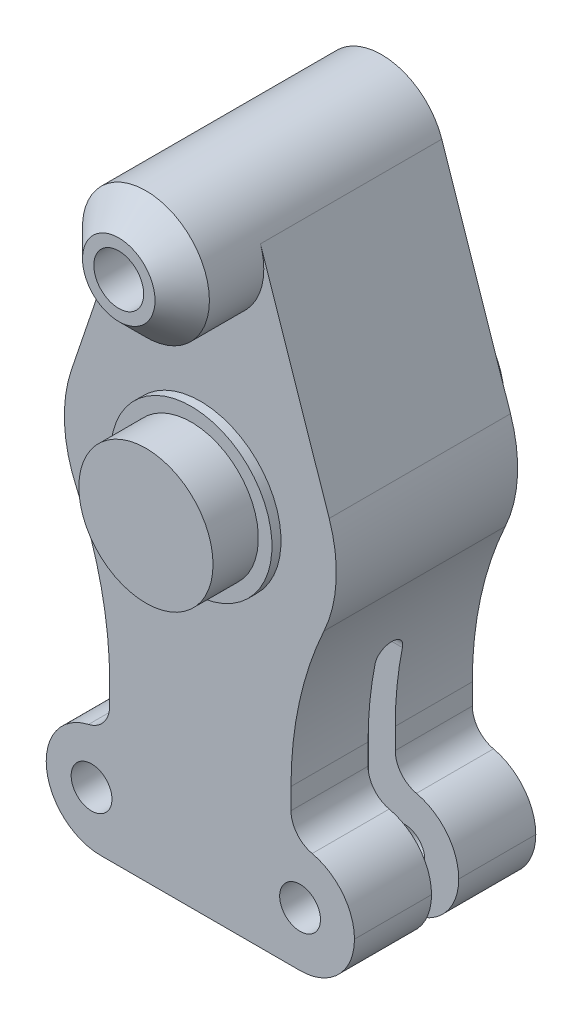
from build123d import *

# Parameters (mm, degrees)
SKETCH_1_R                  = 7.4
EXTRUDE_1_DEPTH             = 5
SKETCH_2_R                  = 8.9
EXTRUDE_2_DEPTH             = 1
SKETCH_3_R                  = 15
EXTRUDE_3_DEPTH             = 20
SKETCH_11_W                 = 20
SKETCH_11_H                 = 20
EXTRUDE_8_DEPTH             = 40
EXTRUDE_4_DEPTH             = 20
EXTRUDE_START               = 9
SKETCH_5_R                  = 7
EXTRUDE_5_DEPTH             = 9
HOLE_WIZARD_M51_D           = 5.5
HOLE_WIZARD_M51_CBORE_D     = 10.5
HOLE_WIZARD_M51_CBORE_DEPTH = 14
CHAMFER_1_SIZE              = 3
FILLET_20_R                 = 40
SKETCH_8_R                  = 9
EXTRUDE_6_DEPTH             = 1
SKETCH_9_R                  = 7.5
EXTRUDE_7_DEPTH             = 5
SKETCH_13_W                 = 34
SKETCH_13_H                 = 20
EXTRUDE_9_DEPTH             = 12
SKETCH_14_R                 = 7.2
CUT_EXTRUDE_3_DEPTH         = 45
SKETCH_15_W                 = 34
SKETCH_15_H                 = 3
CUT_EXTRUDE_4_DEPTH         = 25
CUT_EXTRUDE_5_DEPTH         = 52.166395
CUT_EXTRUDE_5_DEPTH_BACK    = 52.166395
FILLET_14_R                 = 1
CUT_EXTRUDE_6_DEPTH         = 14
CUT_EXTRUDE_7_DEPTH         = 64.584589
SKETCH_19_W                 = 5.4
SKETCH_19_H                 = 10.4
CUT_EXTRUDE_8_DEPTH         = 5
FILLET_15_R                 = 1
FILLET_18_R                 = 0.4
HOLE_WIZARD_M41_D           = 4.5
FILLET_19_R                 = 6
FILLET_21_R                 = 3


with BuildPart() as part:
    # Эскиз1 → Бобышка-Вытянуть1 (new body)
    with BuildSketch(Plane.XY):
        Circle(SKETCH_1_R)
    extrude(amount=EXTRUDE_1_DEPTH)

    # Эскиз2 → Бобышка-Вытянуть2 (add)
    with BuildSketch(Plane(origin=(0, 0, 0), x_dir=(-1, 0, 0), z_dir=(0, 0, -1))):
        Circle(SKETCH_2_R)
    extrude(amount=EXTRUDE_2_DEPTH)

    # Эскиз3 → Бобышка-Вытянуть3 (add)
    with BuildSketch(Plane(origin=(0, 0, -1), x_dir=(-1, 0, 0), z_dir=(0, 0, -1))):
        Circle(SKETCH_3_R)
    extrude(amount=EXTRUDE_3_DEPTH)

    # Эскиз11 → Бобышка-Вытянуть8 (add)
    with BuildSketch(Plane(origin=(0, 0, 0), x_dir=(1, 0, 0), z_dir=(0, 1, 0))):
        with Locations((0, 11)):
            Rectangle(SKETCH_11_W, SKETCH_11_H)
    extrude(amount=-EXTRUDE_8_DEPTH)

    # Эскиз4 → Бобышка-Вытянуть4 (add)
    with BuildSketch(Plane(origin=(0, 0, -1), x_dir=(-1, 0, 0), z_dir=(0, 0, -1))):
        with BuildLine():
            Line((-6.631923, 27.24), (-14.211263, 4.8))
            Line((-14.211263, 4.8), (14.211263, 4.8))
            Line((14.211263, 4.8), (6.631923, 27.24))
            ThreePointArc((6.631923, 27.24), (0, 32), (-6.631923, 27.24))
        make_face()
    extrude(amount=EXTRUDE_4_DEPTH)

    # Эскиз5 → Бобышка-Вытянуть5 (add)
    with BuildSketch(Plane.XY.offset(-1).offset(EXTRUDE_START)):
        with Locations((0, 25)):
            Circle(SKETCH_5_R)
    extrude(amount=-EXTRUDE_5_DEPTH)

    # Цековка для винта с внутренним шестигранником M51 (through all)
    with Locations(Plane(origin=(0.481722, 0.624121, -21), x_dir=(-1, 0, 0), z_dir=(0, 0, -1))):
        with Locations((0.481722, 24.375879)):
            CounterBoreHole(HOLE_WIZARD_M51_D / 2, HOLE_WIZARD_M51_CBORE_D / 2, HOLE_WIZARD_M51_CBORE_DEPTH)

    # Фаска1
    chamfer_1_edges = [part.edges().sort_by_distance(p)[0] for p in [
        (-7, 25, 8),
    ]]
    chamfer(chamfer_1_edges, length=CHAMFER_1_SIZE)

    # Скругление20
    fillet_20_edges = [part.edges().sort_by_distance(p)[0] for p in [
        (10, -11.18034, -11),
        (-10, -11.18034, -11),
    ]]
    fillet(fillet_20_edges, radius=FILLET_20_R)

    # Эскиз8 → Бобышка-Вытянуть6 (add)
    with BuildSketch(Plane(origin=(0, 0, -21), x_dir=(-1, 0, 0), z_dir=(0, 0, -1))):
        Circle(SKETCH_8_R)
    extrude(amount=EXTRUDE_6_DEPTH)

    # Эскиз9 → Бобышка-Вытянуть7 (add)
    with BuildSketch(Plane(origin=(0, 0, -22), x_dir=(-1, 0, 0), z_dir=(0, 0, -1))):
        Circle(SKETCH_9_R)
    extrude(amount=EXTRUDE_7_DEPTH)

    # Эскиз13 → Бобышка-Вытянуть9 (add)
    with BuildSketch(Plane(origin=(0, -40, 0), x_dir=(-1, 0, 0), z_dir=(0, -1, 0))):
        with Locations((0, 11)):
            Rectangle(SKETCH_13_W, SKETCH_13_H)
    extrude(amount=-EXTRUDE_9_DEPTH)

    # Эскиз14 → Вырез-Вытянуть3 (cut)
    with BuildSketch(Plane(origin=(0, -40, 0), x_dir=(-1, 0, 0), z_dir=(0, -1, 0))):
        with Locations(Location((0, 11, 0), (0, 0, 90))):
            Circle(SKETCH_14_R)
    extrude(amount=-CUT_EXTRUDE_3_DEPTH, mode=Mode.SUBTRACT)

    # Эскиз15 → Вырез-Вытянуть4 (cut)
    with BuildSketch(Plane(origin=(0, -40, 0), x_dir=(-1, 0, 0), z_dir=(0, -1, 0))):
        with Locations((0, 11)):
            Rectangle(SKETCH_15_W, SKETCH_15_H)
    extrude(amount=-CUT_EXTRUDE_4_DEPTH, mode=Mode.SUBTRACT)

    # Эскиз16 → Вырез-Вытянуть5 (cut, two sides: drawn at the far end of the back side and taken through both)
    with BuildSketch(Plane(origin=(0, 0, 0), x_dir=(0, 0, -1), z_dir=(1, 0, 0)).offset(-CUT_EXTRUDE_5_DEPTH_BACK)):
        with BuildLine():
            Line((9.5, -15), (12.5, -15))
            ThreePointArc((12.5, -15), (11, -13.5), (9.5, -15))
        make_face()
    extrude(amount=CUT_EXTRUDE_5_DEPTH + CUT_EXTRUDE_5_DEPTH_BACK, mode=Mode.SUBTRACT)

    # Скругление14
    fillet_14_edges = [part.edges().sort_by_distance(p)[0] for p in [
        (0, -40, -3.8),
        (-4.529901, -40, -16.596427),
    ]]
    fillet(fillet_14_edges, radius=FILLET_14_R)

    # Эскиз17 → Вырез-Вытянуть6 (cut)
    with BuildSketch(Plane(origin=(0, 0, -21), x_dir=(-1, 0, 0), z_dir=(0, 0, -1))):
        with BuildLine():
            Line((5.25, 25), (5.25, 15))
            ThreePointArc((5.25, 15), (0, 9.75), (-5.25, 15))
            Line((-5.25, 15), (-5.25, 25))
            ThreePointArc((-5.25, 25), (0, 30.25), (5.25, 25))
        make_face()
    extrude(amount=-CUT_EXTRUDE_6_DEPTH, mode=Mode.SUBTRACT)

    # Эскиз18 → Вырез-Вытянуть7 (cut, through all)
    with BuildSketch(Plane(origin=(0, 15, 0), x_dir=(-1, 0, 0), z_dir=(0, -1, 0))):
        with BuildLine():
            Line((-5.25, 7), (5.25, 7))
            Line((5.25, 7), (5.25, 15.92722))
            ThreePointArc((5.25, 15.92722), (0, 18.2), (-5.25, 15.92722))
            Line((-5.25, 15.92722), (-5.25, 7))
        make_face()
    extrude(amount=CUT_EXTRUDE_7_DEPTH, mode=Mode.SUBTRACT)

    # Эскиз19 → Вырез-Вытянуть8 (cut)
    with BuildSketch(Plane(origin=(0, 0, -27), x_dir=(-1, 0, 0), z_dir=(0, 0, -1))):
        Rectangle(SKETCH_19_W, SKETCH_19_H)
    extrude(amount=-CUT_EXTRUDE_8_DEPTH, mode=Mode.SUBTRACT)

    # Скругление15
    fillet_15_edges = [part.edges().sort_by_distance(p)[0] for p in [
        (5.25, 10, -7),
        (-5.25, 10, -7),
        (0, 30.25, -7),
    ]]
    fillet(fillet_15_edges, radius=FILLET_15_R)

    # Скругление18
    fillet_18_edges = [part.edges().sort_by_distance(p)[0] for p in [
        (-2.7, 5.2, -24.5),
        (-2.7, -5.2, -24.5),
        (2.7, -5.2, -24.5),
        (2.7, 5.2, -24.5),
    ]]
    fillet(fillet_18_edges, radius=FILLET_18_R)

    # Отверстие с зазором M41 (through all)
    with Locations(Plane.XY.offset(-1)):
        with Locations((-12, -34), (11, -34)):
            Hole(HOLE_WIZARD_M41_D / 2)

    # Скругление19
    fillet_19_edges = [part.edges().sort_by_distance(p)[0] for p in [
        (17, -28, -16.75),
        (17, -28, -5.25),
        (17, -40, -5.25),
        (17, -40, -16.75),
        (-17, -28, -16.75),
        (-17, -40, -16.75),
        (-17, -28, -5.25),
        (-17, -40, -5.25),
    ]]
    fillet(fillet_19_edges, radius=FILLET_19_R - 0.0001)  # a hair under: the kernel refuses the full size

    # Скругление21
    fillet_21_edges = [part.edges().sort_by_distance(p)[0] for p in [
        (10, -28, -16.75),
        (10, -28, -5.25),
        (-10, -28, -16.75),
        (-10, -28, -5.25),
    ]]
    fillet(fillet_21_edges, radius=FILLET_21_R)


solid = part.part
